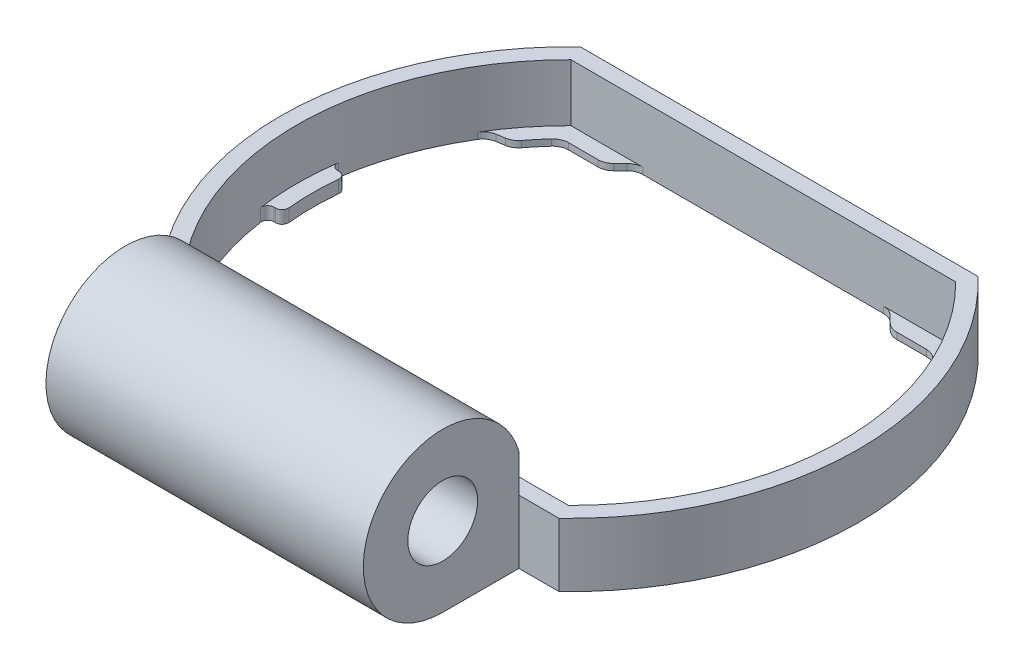
from build123d import *

# Parameters (mm, degrees)
EXTRUDE_1_DEPTH      = 4
EXTRUDE_2_DEPTH      = 0.4
CHAMFER_1_SIZE       = 1
FILLET_1_R           = 1
EXTRUDE_3_DEPTH      = 10
EXTRUDE_3_DEPTH_BACK = 10
SKETCH_3_R           = 2.2
EXTRUDE_4_DEPTH      = 0.8
FILLET_2_R           = 0.4


with BuildPart() as part:
    # 草图1 → 凸台-拉伸1 (new body)
    with BuildSketch(Plane(origin=(0, 0, 0), x_dir=(1, 0, 0), z_dir=(0, 1, 0))):
        with BuildLine():
            Line((-12.529964086, 13.2), (12.529964086, 13.2))
            ThreePointArc((12.529964086, 13.2), (18.2, 0), (12.529964086, -13.2))
            Line((12.529964086, -13.2), (-12.529964086, -13.2))
            ThreePointArc((-12.529964086, -13.2), (-18.2, 0), (-12.529964086, 13.2))
        make_face()
        with BuildLine():
            Line((-12.124355653, 12.2), (12.124355653, 12.2))
            ThreePointArc((12.124355653, 12.2), (17.2, 0), (12.124355653, -12.2))
            Line((12.124355653, -12.2), (-12.124355653, -12.2))
            ThreePointArc((-12.124355653, -12.2), (-17.2, 0), (-12.124355653, 12.2))
        make_face(mode=Mode.SUBTRACT)
    extrude(amount=EXTRUDE_1_DEPTH)

    # 草图2 → 凸台-拉伸2 (add)
    with BuildSketch(Plane.XZ):
        with BuildLine():
            Line((-12.124355653, -12.2), (-9, -12.2))
            Line((-9, -12.2), (-9, -11.2))
            Line((-9, -11.2), (-11.704699911, -11.2))
            ThreePointArc((-11.704699911, -11.2), (-12.433722739, -10.384726228), (-13.106075309, -9.522121087))
            Line((-13.106075309, -9.522121087), (-13.915092303, -10.109906339))
            ThreePointArc((-13.915092303, -10.109906339), (-13.061597733, -11.190829489), (-12.124355653, -12.2))
        make_face()
        with BuildLine():
            Line((9, -12.2), (12.124355653, -12.2))
            ThreePointArc((12.124355653, -12.2), (13.061597733, -11.190829489), (13.915092303, -10.109906339))
            Line((13.915092303, -10.109906339), (13.106075309, -9.522121087))
            ThreePointArc((13.106075309, -9.522121087), (12.433722739, -10.384726228), (11.704699911, -11.2))
            Line((11.704699911, -11.2), (9, -11.2))
            Line((9, -11.2), (9, -12.2))
        make_face()
        with BuildLine():
            Line((13.106075309, 9.522121087), (13.915092303, 10.109906339))
            ThreePointArc((13.915092303, 10.109906339), (13.061597733, 11.190829489), (12.124355653, 12.2))
            Line((12.124355653, 12.2), (9, 12.2))
            Line((9, 12.2), (9, 11.2))
            Line((9, 11.2), (11.704699911, 11.2))
            ThreePointArc((11.704699911, 11.2), (12.433722739, 10.384726228), (13.106075309, 9.522121087))
        make_face()
        with BuildLine():
            ThreePointArc((-12.124355653, 12.2), (-13.061597733, 11.190829489), (-13.915092303, 10.109906339))
            Line((-13.915092303, 10.109906339), (-13.106075309, 9.522121087))
            ThreePointArc((-13.106075309, 9.522121087), (-12.433722739, 10.384726228), (-11.704699911, 11.2))
            Line((-11.704699911, 11.2), (-9, 11.2))
            Line((-9, 11.2), (-9, 12.2))
            Line((-9, 12.2), (-12.124355653, 12.2))
        make_face()
    extrude(amount=-EXTRUDE_2_DEPTH)

    # 倒角1
    # the kernel refuses this chamfer: 1 mm, written as the material it adds along each edge
    with BuildSketch(Plane(origin=(9, 0, -12.2), x_dir=(-1, 0, 0), z_dir=(0, 1, 0))) as chamfer_1_piece_1_section:
        Polygon((CHAMFER_1_SIZE, 0), (0, CHAMFER_1_SIZE), (0, 0), align=None)
    chamfer_1_piece_1 = extrude(amount=0.4, mode=Mode.PRIVATE)
    chamfer_1_piece_1 = split(chamfer_1_piece_1, bisect_by=Plane(origin=(9, 0, -11.2), z_dir=(0, 0, -1)), keep=Keep.TOP, mode=Mode.PRIVATE)
    add(chamfer_1_piece_1)
    with BuildSketch(Plane(origin=(13.915092303, 0, -10.109906339), x_dir=(0.5646701289866782, 0, 0.8253166940212516), z_dir=(0, 1, 0))) as chamfer_1_piece_2_section:
        with BuildLine():
            Line((0.972875022, 0), (CHAMFER_1_SIZE * 0.0282812506504, -CHAMFER_1_SIZE * 0.999600005433))
            Line((CHAMFER_1_SIZE * 0.0282812506504, -CHAMFER_1_SIZE * 0.999600005433), (0, 0))
            ThreePointArc((0, 0), (0.500167916, 0.006874426), (0.972875022, 0))
        make_face()
    chamfer_1_piece_2 = extrude(amount=0.4, mode=Mode.PRIVATE)
    chamfer_1_piece_2 = chamfer_1_piece_2 - Plane(origin=(0, 0, 0), x_dir=(0.8090169943749429, 0, -0.5877852522924794), z_dir=(0, -1, 0)) * Cylinder(16.2, 5, mode=Mode.PRIVATE)
    add(chamfer_1_piece_2)
    with BuildSketch(Plane(origin=(13.915092303, 0, 10.109906339), x_dir=(0.5646701289866733, 0, -0.825316694021255), z_dir=(0, 1, 0))) as chamfer_1_piece_3_section:
        with BuildLine():
            Line((0.972875022, 0), (CHAMFER_1_SIZE * 0.0282812506504, CHAMFER_1_SIZE * 0.999600005433))
            Line((CHAMFER_1_SIZE * 0.0282812506504, CHAMFER_1_SIZE * 0.999600005433), (0, 0))
            ThreePointArc((0, 0), (0.500167916, -0.006874426), (0.972875022, 0))
        make_face()
    chamfer_1_piece_3 = extrude(amount=0.4, mode=Mode.PRIVATE)
    chamfer_1_piece_3 = chamfer_1_piece_3 - Plane(origin=(0, 0, 0), x_dir=(0.7225123401678771, 0, 0.6913580246913591), z_dir=(0, -1, 0)) * Cylinder(16.2, 5, mode=Mode.PRIVATE)
    add(chamfer_1_piece_3)
    with BuildSketch(Plane(origin=(9, 0, 12.2), x_dir=(-1, 0, 0), z_dir=(0, 1, 0))) as chamfer_1_piece_4_section:
        Polygon((CHAMFER_1_SIZE, 0), (0, -CHAMFER_1_SIZE), (0, 0), align=None)
    chamfer_1_piece_4 = extrude(amount=0.4, mode=Mode.PRIVATE)
    chamfer_1_piece_4 = split(chamfer_1_piece_4, bisect_by=Plane(origin=(9, 0, 11.2), z_dir=(0, 0, 1)), keep=Keep.TOP, mode=Mode.PRIVATE)
    add(chamfer_1_piece_4)
    with BuildSketch(Plane(origin=(-9, 0, 12.2), x_dir=(1, 0, 0), z_dir=(0, 1, 0))) as chamfer_1_piece_5_section:
        Polygon((CHAMFER_1_SIZE, 0), (0, CHAMFER_1_SIZE), (0, 0), align=None)
    chamfer_1_piece_5 = extrude(amount=0.4, mode=Mode.PRIVATE)
    chamfer_1_piece_5 = split(chamfer_1_piece_5, bisect_by=Plane(origin=(-9, 0, 11.2), z_dir=(0, 0, 1)), keep=Keep.TOP, mode=Mode.PRIVATE)
    add(chamfer_1_piece_5)
    with BuildSketch(Plane(origin=(-13.915092303, 0, 10.109906339), x_dir=(-0.5646701289866741, 0, -0.8253166940212543), z_dir=(0, 1, 0))) as chamfer_1_piece_6_section:
        with BuildLine():
            Line((0.972875022, 0), (CHAMFER_1_SIZE * 0.0282812506504, -CHAMFER_1_SIZE * 0.999600005433))
            Line((CHAMFER_1_SIZE * 0.0282812506504, -CHAMFER_1_SIZE * 0.999600005433), (0, 0))
            ThreePointArc((0, 0), (0.500167916, 0.006874426), (0.972875022, 0))
        make_face()
    chamfer_1_piece_6 = extrude(amount=0.4, mode=Mode.PRIVATE)
    chamfer_1_piece_6 = chamfer_1_piece_6 - Plane(origin=(0, 0, 0), x_dir=(-0.809016994374947, 0, 0.5877852522924738), z_dir=(0, -1, 0)) * Cylinder(16.2, 5, mode=Mode.PRIVATE)
    add(chamfer_1_piece_6)
    with BuildSketch(Plane(origin=(-13.915092303, 0, -10.109906339), x_dir=(-0.5646701289866836, 0, 0.8253166940212479), z_dir=(0, 1, 0))) as chamfer_1_piece_7_section:
        with BuildLine():
            Line((0.972875022, 0), (CHAMFER_1_SIZE * 0.0282812506504, CHAMFER_1_SIZE * 0.999600005433))
            Line((CHAMFER_1_SIZE * 0.0282812506504, CHAMFER_1_SIZE * 0.999600005433), (0, 0))
            ThreePointArc((0, 0), (0.500167916, -0.006874426), (0.972875022, 0))
        make_face()
    chamfer_1_piece_7 = extrude(amount=0.4, mode=Mode.PRIVATE)
    chamfer_1_piece_7 = chamfer_1_piece_7 - Plane(origin=(0, 0, 0), x_dir=(-0.7225123401678729, 0, -0.6913580246913635), z_dir=(0, -1, 0)) * Cylinder(16.2, 5, mode=Mode.PRIVATE)
    add(chamfer_1_piece_7)
    with BuildSketch(Plane(origin=(-9, 0, -12.2), x_dir=(1, 0, 0), z_dir=(0, 1, 0))) as chamfer_1_piece_8_section:
        Polygon((CHAMFER_1_SIZE, 0), (0, -CHAMFER_1_SIZE), (0, 0), align=None)
    chamfer_1_piece_8 = extrude(amount=0.4, mode=Mode.PRIVATE)
    chamfer_1_piece_8 = split(chamfer_1_piece_8, bisect_by=Plane(origin=(-9, 0, -11.2), z_dir=(0, 0, -1)), keep=Keep.TOP, mode=Mode.PRIVATE)
    add(chamfer_1_piece_8)

    # 圆角1
    fillet_1_edges = [part.edges().sort_by_distance(p)[0] for p in [
        (-8, 0.2, -12.2),
        (8, 0.2, -12.2),
        (14.464445768, 0.2, 9.306976342),
        (14.464445768, 0.2, -9.306976342),
        (-8, 0.2, 12.2),
        (8, 0.2, 12.2),
        (-14.464445768, 0.2, -9.306976342),
        (-14.464445768, 0.2, 9.306976342),
        (-11.704699911, 0.2, -11.2),
        (-9, 0.2, -11.2),
        (-13.106075309, 0.2, -9.522121087),
        (11.704699911, 0.2, -11.2),
        (13.106075309, 0.2, -9.522121087),
        (9, 0.2, -11.2),
        (11.704699911, 0.2, 11.2),
        (9, 0.2, 11.2),
        (13.106075309, 0.2, 9.522121087),
        (-11.704699911, 0.2, 11.2),
        (-13.106075309, 0.2, 9.522121087),
        (-9, 0.2, 11.2),
    ]]
    fillet(fillet_1_edges, radius=FILLET_1_R)

    # 草图3 → 凸台-拉伸3 (add, two sides: drawn at the far end of the back side and taken through both)
    with BuildSketch(Plane(origin=(0, 0, 0), x_dir=(0, 0, -1), z_dir=(1, 0, 0)).offset(-EXTRUDE_3_DEPTH_BACK)):
        with BuildLine():
            Line((-18, 0), (-13.2, 0))
            Line((-13.2, 0), (-13.2, 4))
            Line((-13.2, 4), (-13.2, 6.4))
            ThreePointArc((-13.2, 6.4), (-22, 8), (-18, 0))
        make_face()
        with Locations((-18, 5)):
            Circle(SKETCH_3_R, mode=Mode.SUBTRACT)
    extrude(amount=EXTRUDE_3_DEPTH + EXTRUDE_3_DEPTH_BACK)

    # 草图4 → 凸台-拉伸4 (add)
    with BuildSketch(Plane.XZ):
        with BuildLine():
            Line((16.076069171, 2), (17.083325203, 2))
            ThreePointArc((17.083325203, 2), (17.2, 0), (17.083325203, -2))
            Line((17.083325203, -2), (16.076069171, -2))
            ThreePointArc((16.076069171, -2), (16.2, 0), (16.076069171, 2))
        make_face()
        with BuildLine():
            Line((-16.076069171, 2), (-17.083325203, 2))
            ThreePointArc((-17.083325203, 2), (-17.2, 0), (-17.083325203, -2))
            Line((-17.083325203, -2), (-16.076069171, -2))
            ThreePointArc((-16.076069171, -2), (-16.2, 0), (-16.076069171, 2))
        make_face()
    extrude(amount=-EXTRUDE_4_DEPTH)

    # 圆角2
    fillet_2_edges = [part.edges().sort_by_distance(p)[0] for p in [
        (17.083325203, 0.4, 2),
        (17.083325203, 0.4, -2),
        (16.076069171, 0.4, -2),
        (16.076069171, 0.4, 2),
        (-16.076069171, 0.4, 2),
        (-16.076069171, 0.4, -2),
        (-17.083325203, 0.4, -2),
        (-17.083325203, 0.4, 2),
    ]]
    fillet(fillet_2_edges, radius=FILLET_2_R)


solid = part.part
